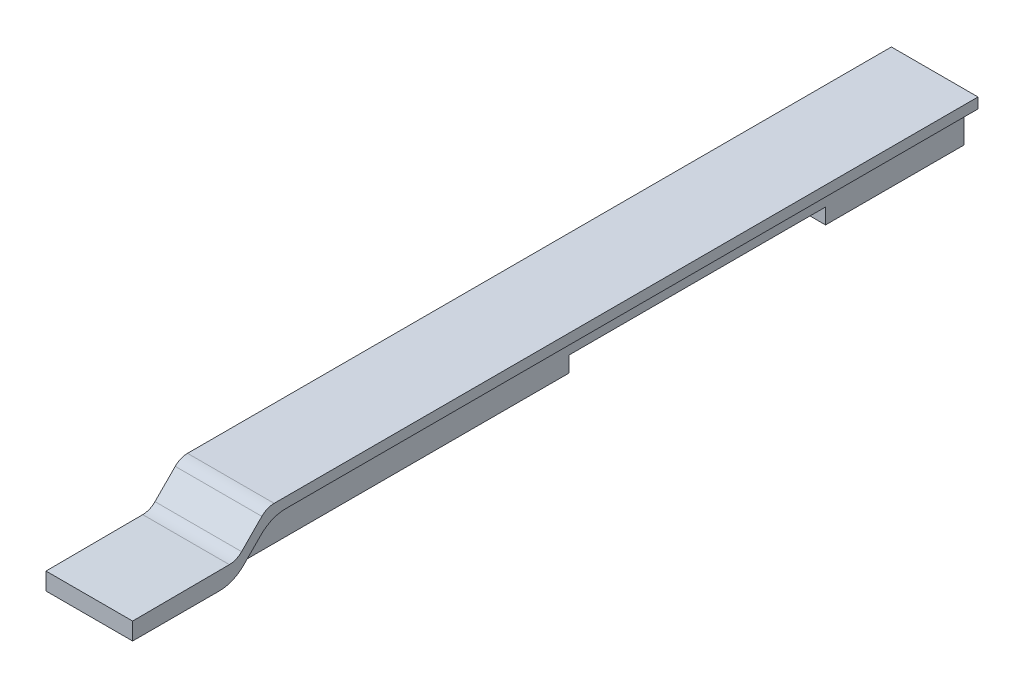
from build123d import *

# Parameters (mm, degrees)
BOSS_EXTRUDE1_DEPTH = 25
CUT_EXTRUDE2_DEPTH  = 4
FILLET6_R           = 10
FILLET7_R           = 5


with BuildPart() as part:
    # Sketch1 → Boss-Extrude1 (new body)
    with BuildSketch(Plane(origin=(0, 0, 0), x_dir=(0, 0, -1), z_dir=(1, 0, 0))):
        Polygon((0, 0), (-130, 0), (-130, 5), (-100.000366453, 5.148280317), (-91.235719846, 14), (114, 14), (114, 0), (74, 0), (74, 4.5), (0, 4.5), align=None)
    extrude(amount=BOSS_EXTRUDE1_DEPTH)

    # Sketch6 → Cut-Extrude2 (cut)
    with BuildSketch(Plane(origin=(25, 0, 0), x_dir=(0, 0, -1), z_dir=(1, 0, 0))):
        Polygon((-100.876178749, 0), (114, 0), (114, 11), (-89.984384146, 11), align=None)
    cut_extrude2 = extrude(amount=-CUT_EXTRUDE2_DEPTH, mode=Mode.SUBTRACT)

    # Mirror3: Cut-Extrude2 across plane
    add(cut_extrude2.mirror(Plane(origin=(12.5, 0, 0), x_dir=(0, 0, 1), z_dir=(1, 0, 0))), mode=Mode.SUBTRACT)

    # Fillet6
    fillet6_edges = [part.edges().sort_by_distance(p)[0] for p in [
        (2, 11, 89.984384146),
        (2, 0, 100.876178749),
        (23, 0, 100.876178749),
        (23, 11, 89.984384146),
    ]]
    fillet(fillet6_edges, radius=FILLET6_R)

    # Fillet7
    fillet7_edges = [part.edges().sort_by_distance(p)[0] for p in [
        (12.5, 14, 91.235719846),
        (12.5, 5.148280317, 100.000366453),
    ]]
    fillet(fillet7_edges, radius=FILLET7_R)


solid = part.part
